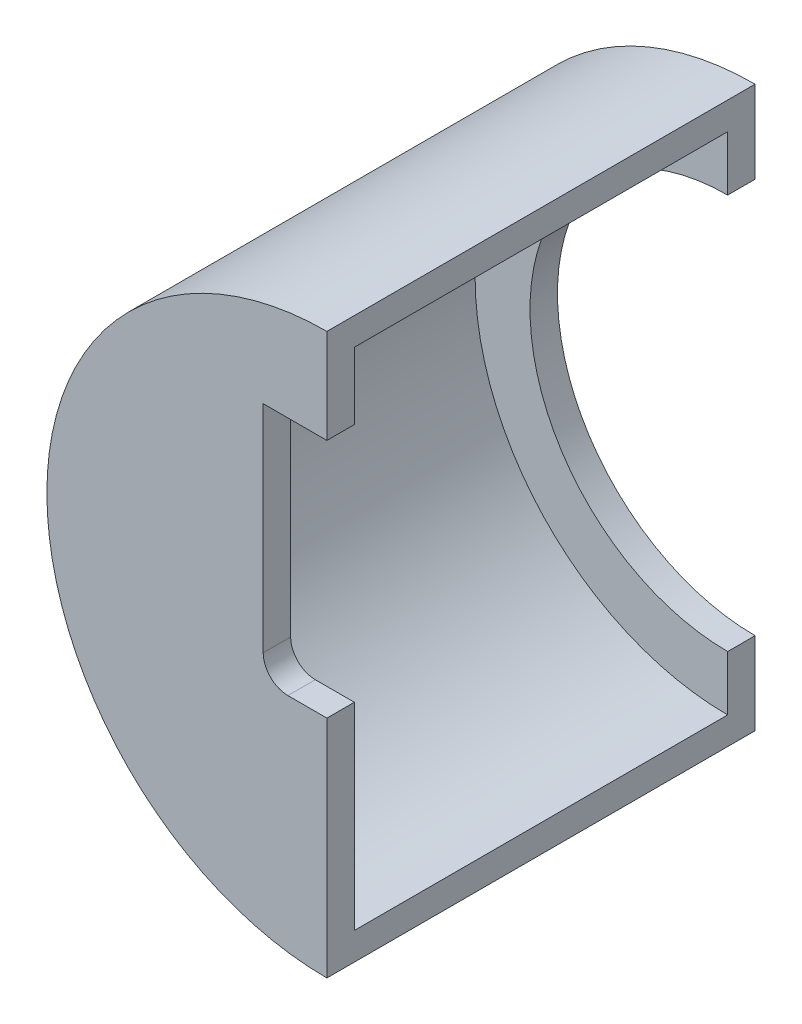
from build123d import *

# Parameters (mm, degrees)
BOSS_EXTRU_1_DEPTH      = 34
BOSS_EXTRU_2_START      = 5
BOSS_EXTRU_2_DEPTH      = 5
BOSS_EXTRU_3_DEPTH      = 5
ENL_V_MAT_EXTRU_1_DEPTH = 10


with BuildPart() as part:
    # Esquisse1 → Boss.-Extru.1 (new, symmetric)
    with BuildSketch(Plane.XY):
        with BuildLine():
            Line((0, 51), (0, 46))
            ThreePointArc((0, 46), (-46, 0), (0, -46))
            Line((0, -46), (0, -51))
            ThreePointArc((0, -51), (-51, 0), (0, 51))
        make_face()
    extrude(amount=BOSS_EXTRU_1_DEPTH, both=True)

    # Esquisse2 → Boss.-Extru.2 (add)
    with BuildSketch(Plane.XY.offset(34).offset(BOSS_EXTRU_2_START)):
        with BuildLine():
            Line((0, 51), (0, -51))
            ThreePointArc((0, -51), (-51, 0), (0, 51))
        make_face()
    extrude(amount=-BOSS_EXTRU_2_DEPTH)

    # Esquisse3 → Boss.-Extru.3 (add)
    with BuildSketch(Plane(origin=(0, 0, -34), x_dir=(-1, 0, 0), z_dir=(0, 0, -1))):
        with BuildLine():
            Line((0, 51), (0, 36))
            ThreePointArc((0, 36), (36, 0), (0, -36))
            Line((0, -36), (0, -51))
            ThreePointArc((0, -51), (51, 0), (0, 51))
        make_face()
    extrude(amount=BOSS_EXTRU_3_DEPTH)

    # Esquisse4 → Enlèv. mat.-Extru.1 (cut)
    with BuildSketch(Plane.XY.offset(39)):
        with BuildLine():
            ThreePointArc((-11.59999996, -5.499999956), (-10.281980449, -8.681980534), (-7.099999871, -10.000000044))
            Line((-7.099999871, -10.000000044), (0, -10.000000044))
            Line((0, -10.000000044), (0, -2.15))
            ThreePointArc((0, -2.15), (2.15, 0), (0, 2.15))
            Line((0, 2.15), (0, 33.8))
            Line((0, 33.8), (-11.59999996, 33.8))
            Line((-11.59999996, 33.8), (-11.59999996, -5.499999956))
        make_face()
    extrude(amount=-ENL_V_MAT_EXTRU_1_DEPTH, mode=Mode.SUBTRACT)


solid = part.part
